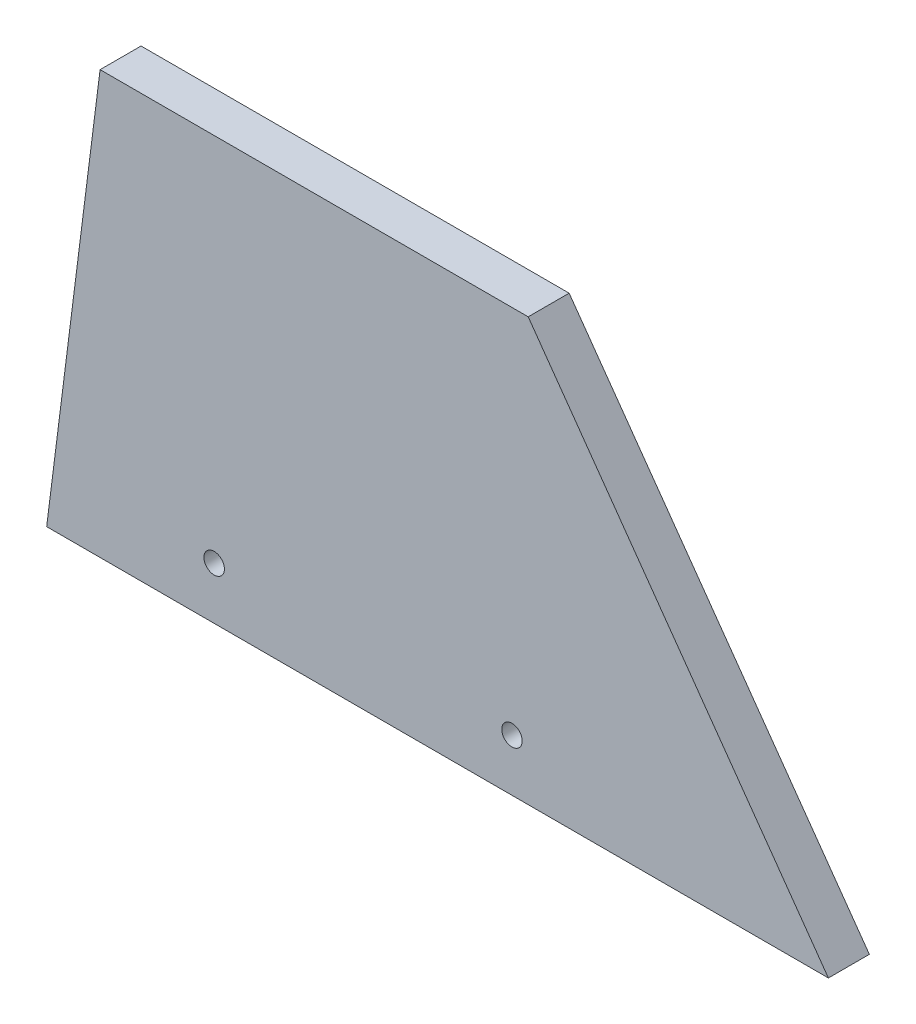
from build123d import *

# Parameters (mm, degrees)
BOSS_EXTRU_1_DEPTH = 11
D_GAGEMENT_M51_D   = 5.5


with BuildPart() as part:
    # Esquisse1 → Boss.-Extru.1 (new body)
    with BuildSketch(Plane.XY):
        Polygon((0, 0), (14.35704771, 113.5), (129.35704771, 113.5), (210, 0), align=None)
    extrude(amount=BOSS_EXTRU_1_DEPTH)

    # Dégagement M51 (through all)
    with Locations(Plane.XY.offset(11)):
        with Locations((125, 14), (45, 14)):
            Hole(D_GAGEMENT_M51_D / 2)


solid = part.part
